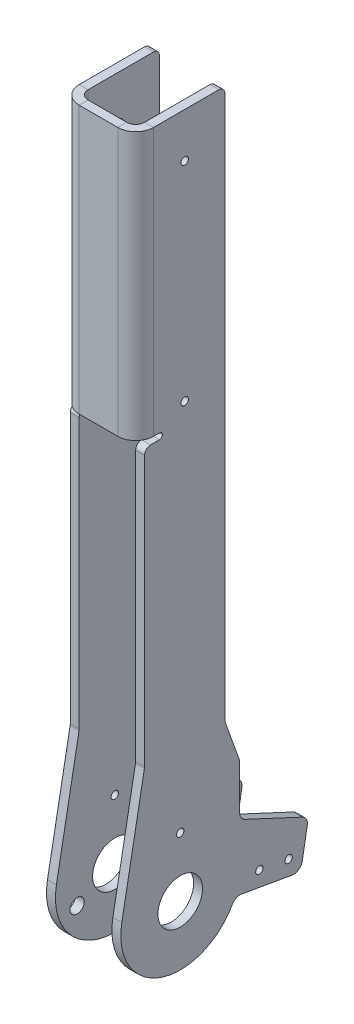
from build123d import *

# Parameters (mm, degrees)
SKETCH1_R              = 7.5
SKETCH1_R_2            = 1.25
BOSS_EXTRUDE1_DEPTH    = 3
FILLET1_R              = 3
SKETCH4_W              = 3
SKETCH4_H              = 175
BOSS_EXTRUDE3_DEPTH    = 27
SKETCH5_R              = 1.25
CUT_EXTRUDE2_DEPTH     = 212.917436753
FILLET4_R              = 2
SKETCH12_W             = 3
SKETCH12_H             = 90
BOSS_EXTRUDE5_DEPTH    = 12.5
CUT_EXTRUDE1_START     = -22
SKETCH2_R              = 2.4
CUT_EXTRUDE1_DEPTH     = 192.365882934
CUT_EXTRUDE8_DEPTH     = 214.365882934
FILLET5_R              = 2
SKETCH51_R             = 1.25
CUT_EXTRUDE9_DEPTH     = 214.365882934
CONVERT_SOLID9_START   = 110
CONVERT_SOLID9_DEPTH   = 90
CONVERT_SOLID9_2_DEPTH = 90


# Read off the part's stored shape, not the designer's step: Convert-Solid9
with BuildPart() as part:
    # Sketch1 → Boss-Extrude1 (new body)
    with BuildSketch(Plane(origin=(0, 0, 0), x_dir=(0, 0, -1), z_dir=(1, 0, 0))):
        with BuildLine():
            Line((-30, -16.155216865), (-30, 1))
            Line((-30, 1), (-35, 15))
            Line((-35, 15), (-35, 25))
            Line((-35, 25), (-62, 25))
            Line((-62, 25), (-62, 15))
            Line((-62, 15), (-69.665068474, -26.355129371))
            ThreePointArc((-69.665068474, -26.355129371), (-55.754353698, -49.154305352), (-31.582037919, -37.796067776))
            Line((-31.582037919, -37.796067776), (-9.457329759, -41.697250765))
            Line((-9.457329759, -41.697250765), (-6.856499335, -26.947208462))
            Line((-6.856499335, -26.947208462), (-30, -16.155216865))
        make_face()
        with Locations((-50, -30)):
            Circle(SKETCH1_R, mode=Mode.SUBTRACT)
        with Locations((-23.361205166, -34.168489335)):
            Circle(SKETCH1_R_2, mode=Mode.SUBTRACT)
        with Locations((-13.513127636, -35.904971111)):
            Circle(SKETCH1_R_2, mode=Mode.SUBTRACT)
    extrude(amount=BOSS_EXTRUDE1_DEPTH)

    # Fillet1
    fillet1_edges = [part.edges().sort_by_distance(p)[0] for p in [
        (1.5, 15, 35),
        (1.5, 1, 30),
        (1.5, -16.155216865, 30),
        (1.5, -26.947208462, 6.856499335),
        (1.5, -41.697250765, 9.457329759),
        (1.5, -37.796067776, 31.582037919),
        (1.5, 15, 62),
    ]]
    fillet(fillet1_edges, radius=FILLET1_R)

    # Sketch4 → Boss-Extrude3 (add)
    with BuildSketch(Plane(origin=(0, 0, 35), x_dir=(-1, 0, 0), z_dir=(0, 0, -1))):
        with Locations((-1.5, 112.5)):
            Rectangle(SKETCH4_W, SKETCH4_H)
    extrude(amount=-BOSS_EXTRUDE3_DEPTH)

    # Sketch5 → Cut-Extrude2 (cut, through all)
    with BuildSketch(Plane.ZY):
        with Locations((48.5, 185)):
            Circle(SKETCH5_R)
        with Locations((48.5, 115)):
            Circle(SKETCH5_R)
    extrude(amount=-CUT_EXTRUDE2_DEPTH, mode=Mode.SUBTRACT)

    # Fillet4
    fillet4_edges = [part.edges().sort_by_distance(p)[0] for p in [
        (1.5, 200, 35),
    ]]
    fillet(fillet4_edges, radius=FILLET4_R)

    # Sketch12 → Boss-Extrude5 (add)
    with BuildSketch(Plane(origin=(3, 0, 0), x_dir=(0, 0, -1), z_dir=(1, 0, 0))):
        with Locations((-63.5, 155)):
            Rectangle(SKETCH12_W, SKETCH12_H)
    extrude(amount=-BOSS_EXTRUDE5_DEPTH)

    # Mirror2: part across plane


with BuildPart() as part_1:
    add(part.part)
    add(part.part.mirror(Plane.ZY.offset(9.5)))

    # Sketch2 → Cut-Extrude1 (cut, through all)
    with BuildSketch(Plane(origin=(3, 0, 0), x_dir=(0, 0, -1), z_dir=(1, 0, 0)).offset(CUT_EXTRUDE1_START)):
        with Locations(Location((-62.688309019, -35.916655664, 0), (0, 0, 180))):
            Circle(SKETCH2_R)
    extrude(amount=-CUT_EXTRUDE1_DEPTH, mode=Mode.SUBTRACT)

    # Sketch50 → Cut-Extrude8 (cut, through all)
    with BuildSketch(Plane(origin=(3, 0, 0), x_dir=(0, 0, -1), z_dir=(1, 0, 0))):
        with BuildLine():
            Line((-62, 110), (-57, 110))
            ThreePointArc((-57, 110), (-56, 109), (-57, 108))
            Line((-57, 108), (-62, 108))
            Line((-62, 108), (-62, 110))
        make_face()
    extrude(amount=-CUT_EXTRUDE8_DEPTH, mode=Mode.SUBTRACT)

    # Fillet5
    fillet5_edges = [part_1.edges().sort_by_distance(p)[0] for p in [
        (1.5, 108, 62),
        (-20.5, 108, 62),
    ]]
    fillet(fillet5_edges, radius=FILLET5_R)

    # Sketch51 → Cut-Extrude9 (cut, through all)
    with BuildSketch(Plane.ZY.offset(22)):
        with Locations((50, -10)):
            Circle(SKETCH51_R)
    extrude(amount=-CUT_EXTRUDE9_DEPTH, mode=Mode.SUBTRACT)

    # Convert-Solid9 outline → Convert-Solid9 (cut)
    with BuildSketch(Plane(origin=(0, 0, 0), x_dir=(1, 0, 0), z_dir=(0, 1, 0)).offset(CONVERT_SOLID9_START)):
        with BuildLine():
            Line((-3, -65), (3, -65))
            Line((3, -65), (3, -59))
            ThreePointArc((3, -59), (1.242640687, -63.242640687), (-3, -65))
        make_face()
        with BuildLine():
            Line((-22, -65), (-16, -65))
            ThreePointArc((-16, -65), (-20.242640687, -63.242640687), (-22, -59))
            Line((-22, -59), (-22, -65))
        make_face()
    extrude(amount=CONVERT_SOLID9_DEPTH, mode=Mode.SUBTRACT)

    # Convert-Solid9 2 outline → Convert-Solid9 2 (add)
    with BuildSketch(Plane(origin=(0, 0, 0), x_dir=(1, 0, 0), z_dir=(0, 1, 0)).offset(CONVERT_SOLID9_START)):
        with BuildLine():
            Line((0, -62), (0, -59))
            ThreePointArc((0, -59), (-0.878679656, -61.121320344), (-3, -62))
            Line((-3, -62), (0, -62))
        make_face()
        with BuildLine():
            Line((-19, -62), (-16, -62))
            ThreePointArc((-16, -62), (-18.121320344, -61.121320344), (-19, -59))
            Line((-19, -59), (-19, -62))
        make_face()
    extrude(amount=CONVERT_SOLID9_2_DEPTH)


solid = part_1.part
